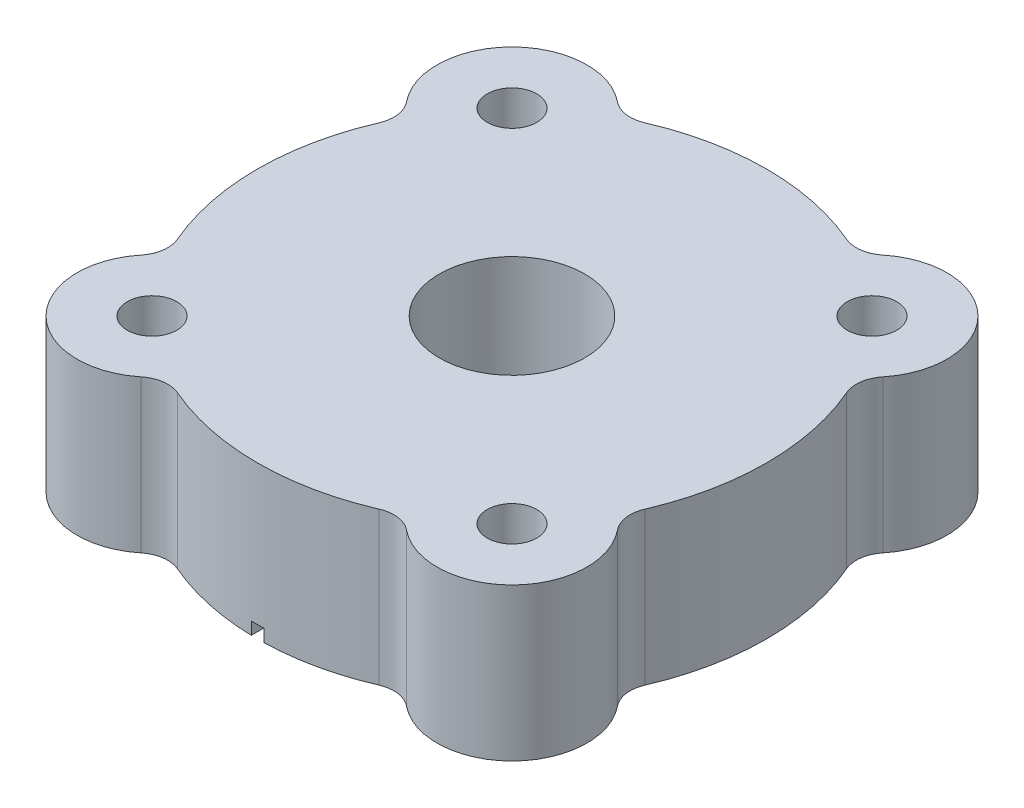
from build123d import *

# Parameters (mm, degrees)
SKETCH1_R                 = 3.96875
SKETCH1_R_2               = 10.1459
BODY_AND_MAIN_HOLES_DEPTH = 24.4122
SKETCH3_R                 = 11.6459
SEAL_BORE_DEPTH           = 22.4122
SKETCH4_W                 = 2
SKETCH4_H                 = 81.5
VENT_SLOT_DEPTH           = 2


with BuildPart() as part:
    # Sketch1 → body and main holes (new body)
    with BuildSketch(Plane(origin=(0, 0, 0), x_dir=(1, 0, 0), z_dir=(0, 1, 0))):
        with BuildLine():
            ThreePointArc((-21.253798436, 38.13309153), (-37.299882708, 37.299882708), (-38.13309153, 21.253798436))
            ThreePointArc((-38.13309153, 21.253798436), (-37.062920165, 18.788316543), (-37.42390553, 16.124943252))
            ThreePointArc((-37.42390553, 16.124943252), (-40.75, 0), (-37.42390553, -16.124943252))
            ThreePointArc((-37.42390553, -16.124943252), (-37.062920165, -18.788316543), (-38.13309153, -21.253798436))
            ThreePointArc((-38.13309153, -21.253798436), (-37.299882708, -37.299882708), (-21.253798436, -38.13309153))
            ThreePointArc((-21.253798436, -38.13309153), (-18.788316543, -37.062920165), (-16.124943252, -37.42390553))
            ThreePointArc((-16.124943252, -37.42390553), (0, -40.75), (16.124943252, -37.42390553))
            ThreePointArc((16.124943252, -37.42390553), (18.788316543, -37.062920165), (21.253798436, -38.13309153))
            ThreePointArc((21.253798436, -38.13309153), (37.299882708, -37.299882708), (38.13309153, -21.253798436))
            ThreePointArc((38.13309153, -21.253798436), (37.062920165, -18.788316543), (37.42390553, -16.124943252))
            ThreePointArc((37.42390553, -16.124943252), (40.75, 0), (37.42390553, 16.124943252))
            ThreePointArc((37.42390553, 16.124943252), (37.062920165, 18.788316543), (38.13309153, 21.253798436))
            ThreePointArc((38.13309153, 21.253798436), (37.299882708, 37.299882708), (21.253798436, 38.13309153))
            ThreePointArc((21.253798436, 38.13309153), (18.788316543, 37.062920165), (16.124943252, 37.42390553))
            ThreePointArc((16.124943252, 37.42390553), (0, 40.75), (-16.124943252, 37.42390553))
            ThreePointArc((-16.124943252, 37.42390553), (-18.788316543, 37.062920165), (-21.253798436, 38.13309153))
        make_face()
        with Locations((-28.814601333, 28.814601333)):
            Circle(SKETCH1_R, mode=Mode.SUBTRACT)
        with Locations((28.814601333, 28.814601333)):
            Circle(SKETCH1_R, mode=Mode.SUBTRACT)
        with Locations((28.814601333, -28.814601333)):
            Circle(SKETCH1_R, mode=Mode.SUBTRACT)
        with Locations((-28.814601333, -28.814601333)):
            Circle(SKETCH1_R, mode=Mode.SUBTRACT)
        Circle(SKETCH1_R_2, mode=Mode.SUBTRACT)
    extrude(amount=BODY_AND_MAIN_HOLES_DEPTH)

    # Sketch3 → seal bore (cut)
    with BuildSketch(Plane.XZ.offset(-24.4122)):
        Circle(SKETCH3_R)
    extrude(amount=SEAL_BORE_DEPTH, mode=Mode.SUBTRACT)

    # Sketch4 → vent slot (cut)
    with BuildSketch(Plane.XZ):
        Rectangle(SKETCH4_W, SKETCH4_H)
    extrude(amount=-VENT_SLOT_DEPTH, mode=Mode.SUBTRACT)


solid = part.part
